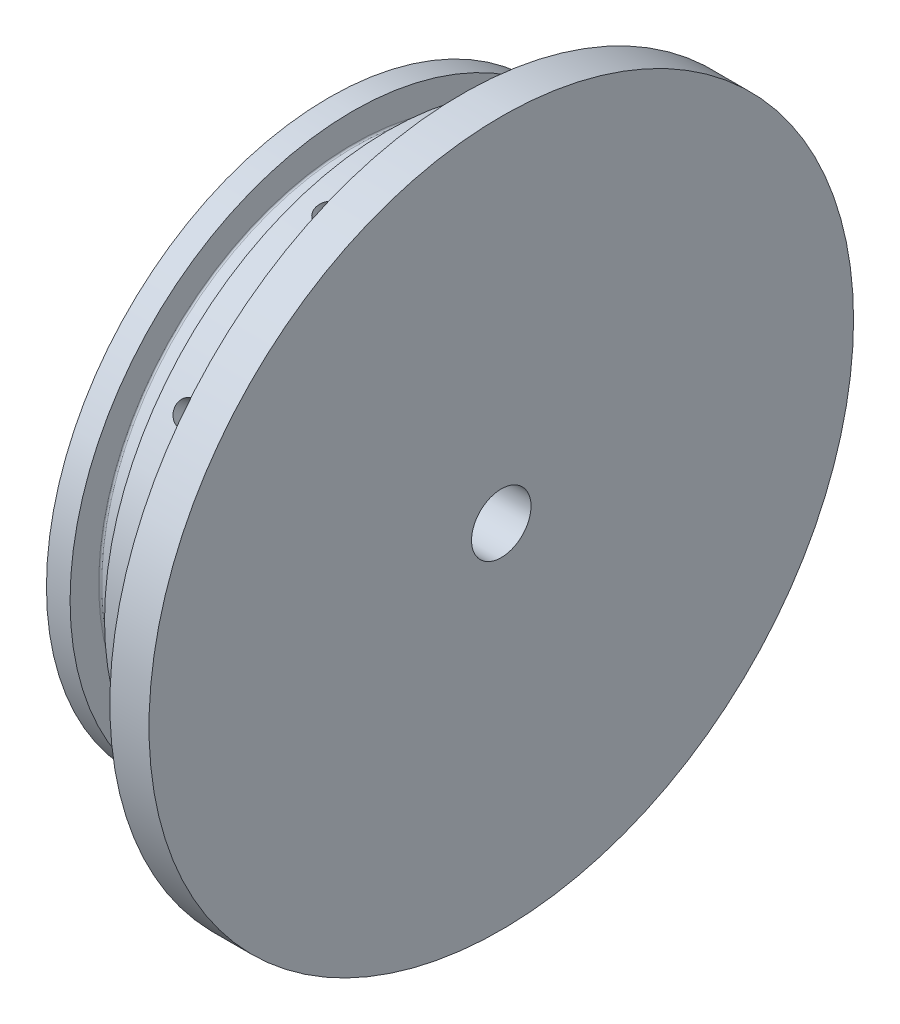
from build123d import *

# Parameters (mm, degrees)
SKETCH1_R           = 57.15
BOSS_EXTRUDE1_DEPTH = 6.35
SKETCH2_R           = 45.847
BOSS_EXTRUDE2_DEPTH = 21.59
SKETCH3_R           = 34.925
CUT_EXTRUDE1_DEPTH  = 6.35
SKETCH11_R          = 1.89865
CUT_EXTRUDE3_DEPTH  = 10.16
CIRPATTERN1_COUNT   = 10
SKETCH15_R          = 4.826
CUT_EXTRUDE4_DEPTH  = 86.515429017


with BuildPart() as part:
    # Sketch1 → Boss-Extrude1 (new body)
    with BuildSketch(Plane(origin=(0, 0, 0), x_dir=(0, 0, -1), z_dir=(1, 0, 0))):
        Circle(SKETCH1_R)
    extrude(amount=BOSS_EXTRUDE1_DEPTH)

    # Sketch2 → Boss-Extrude2 (add)
    with BuildSketch(Plane.ZY):
        Circle(SKETCH2_R)
    extrude(amount=BOSS_EXTRUDE2_DEPTH)

    # Sketch3 → Cut-Extrude1 (cut)
    with BuildSketch(Plane.ZY.offset(21.59)):
        Circle(SKETCH3_R)
    extrude(amount=-CUT_EXTRUDE1_DEPTH, mode=Mode.SUBTRACT)

    # Sketch11 → Cut-Extrude3 (cut)
    with BuildSketch(Plane(origin=(0, 0, -45.847), x_dir=(-1, 0, 0), z_dir=(0, 0, -1))):
        with Locations((7.62, 0)):
            Circle(SKETCH11_R)
    cut_extrude3 = extrude(amount=-CUT_EXTRUDE3_DEPTH, mode=Mode.SUBTRACT)

    # CirPattern1: Cut-Extrude3 ×10 about axis
    cirpattern1_axis = Axis((0, 0, 0), (-1, 0, 0))
    for i in range(1, CIRPATTERN1_COUNT):
        add(cut_extrude3.rotate(cirpattern1_axis, i * 360 / CIRPATTERN1_COUNT), mode=Mode.SUBTRACT)

    # Sketch13 → Cut-Revolve3 (revolve, cut)
    with BuildSketch(Plane.XY):
        with BuildLine():
            Line((-17.757455489, 45.847), (-12.169455489, 45.847))
            Line((-12.169455489, 45.847), (-12.169455489, 41.2115))
            ThreePointArc((-12.169455489, 41.2115), (-12.243850367, 41.031894878), (-12.423455489, 40.9575))
            Line((-12.423455489, 40.9575), (-17.503455489, 40.9575))
            ThreePointArc((-17.503455489, 40.9575), (-17.683060611, 41.031894878), (-17.757455489, 41.2115))
            Line((-17.757455489, 41.2115), (-17.757455489, 45.847))
        make_face()
    revolve(axis=Axis((0, 0, 0), (-1, 0, 0)), mode=Mode.SUBTRACT)

    # Sketch15 → Cut-Extrude4 (cut, through all)
    with BuildSketch(Plane(origin=(6.35, 0, 0), x_dir=(0, 0, -1), z_dir=(1, 0, 0))):
        Circle(SKETCH15_R)
    extrude(amount=-CUT_EXTRUDE4_DEPTH, mode=Mode.SUBTRACT)


solid = part.part
